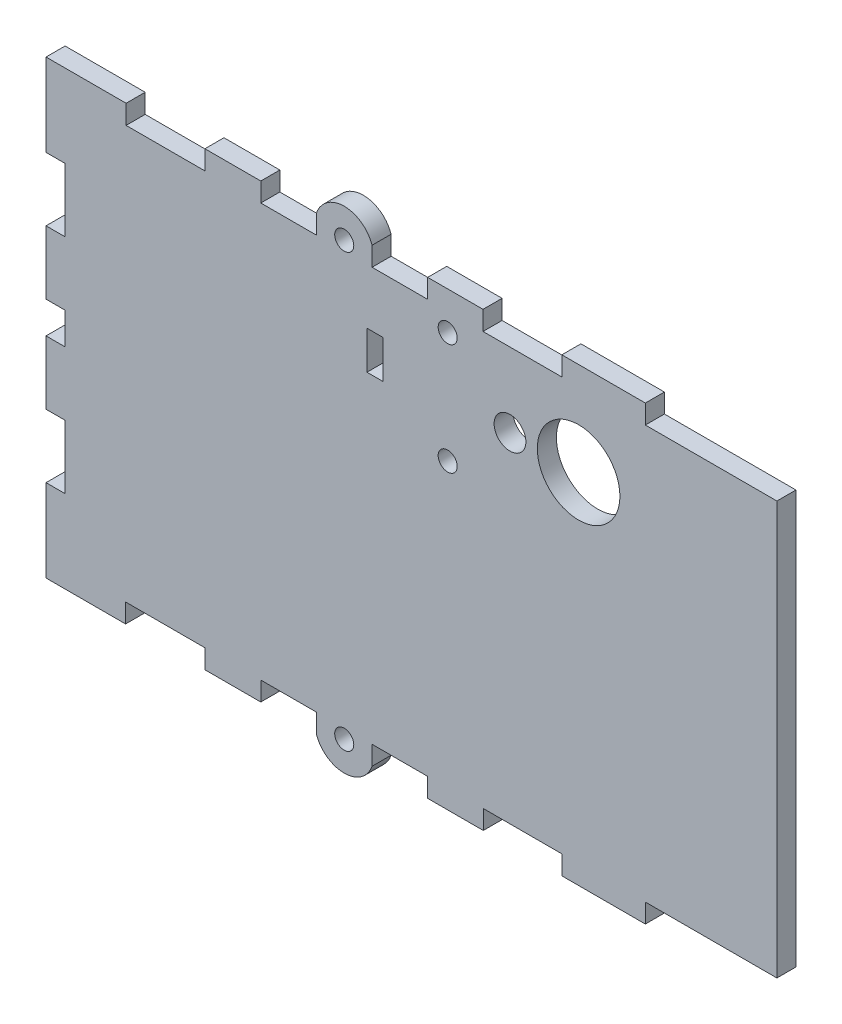
from build123d import *

# Parameters (mm, degrees)
CROQUIS1_R              = 1.500000001
SALIENTE_EXTRUIR1_DEPTH = 3
CROQUIS4_W              = 3
CROQUIS4_H              = 71.0001277
SALIENTE_EXTRUIR2_DEPTH = 15
CROQUIS5_R              = 6.5
CROQUIS5_R_2            = 1.5
CROQUIS5_R_3            = 2.5
CROQUIS5_W              = 2.499996062
CROQUIS5_H              = 6.000001641
CORTAR_EXTRUIR1_DEPTH   = 10
CORTAR_EXTRUIR3_START   = -3
CORTAR_EXTRUIR3_DEPTH   = 3


# Read off the part's stored shape, not the designer's step: Cortar-Extruir3
with BuildPart() as part:
    # Croquis1 → Saliente-Extruir1 (new body)
    with BuildSketch(Plane.XY):
        with BuildLine():
            Line((314.494178041, 188.579504075), (317.494178043, 188.579506619))
            Line((317.494178043, 188.579506619), (317.494186524, 178.579506615))
            Line((317.494186524, 178.579506615), (314.494177731, 178.579504071))
            Line((314.494177731, 178.579504071), (314.494186212, 168.579504067))
            Line((314.494186212, 168.579504067), (317.494186214, 168.579506611))
            Line((317.494186214, 168.579506611), (317.494190454, 163.579648323))
            Line((317.494190454, 163.579648323), (314.494168474, 163.579645778))
            Line((314.494168474, 163.579645778), (314.494176956, 153.579645774))
            Line((314.494176956, 153.579645774), (317.494159374, 153.579648318))
            Line((317.494159374, 153.579648318), (317.494167855, 143.579648314))
            Line((317.494167855, 143.579648314), (314.494167854, 143.57964577))
            Line((314.494167854, 143.57964577), (314.494173605, 130.579645765))
            Line((314.494173605, 130.579645765), (327.013519861, 130.579618443))
            Line((327.013519861, 130.579618443), (327.013522591, 133.579618444))
            Line((327.013522591, 133.579618444), (339.532765197, 133.579591123))
            Line((339.532765197, 133.579591123), (339.532765197, 130.57943755))
            Line((339.532765197, 130.57943755), (348.284914925, 130.579428178))
            Line((348.284914925, 130.579428178), (348.284918137, 133.579395242))
            Line((348.284918137, 133.579395242), (357.034918141, 133.579385871))
            Line((357.034918141, 133.579385871), (357.034914928, 130.57938587))
            ThreePointArc((357.034914928, 130.57938587), (361.414562849, 127.449962294), (365.794217472, 130.57937649))
            Line((365.794217472, 130.57937649), (365.794220685, 133.579299126))
            Line((365.794220685, 133.579299126), (374.544220688, 133.579289756))
            Line((374.544220688, 133.579289756), (374.544217476, 130.579290106))
            Line((374.544217476, 130.579290106), (383.294100119, 130.579288157))
            Line((383.294100119, 130.579288157), (383.294100787, 133.579288158))
            Line((383.294100787, 133.579288158), (395.694123645, 133.579285396))
            Line((395.694123645, 133.579285396), (395.694122977, 130.579285394))
            Line((395.694122977, 130.579285394), (414.49422245, 130.579281206))
            Line((414.49422245, 130.579281206), (414.494175849, 201.579408906))
            Line((414.494175849, 201.579408906), (395.654796079, 201.579436111))
            Line((395.654796079, 201.579436111), (395.654796079, 198.559911251))
            Line((395.654796079, 198.559911251), (383.254781657, 198.559889448))
            Line((383.254781657, 198.559889448), (383.254781657, 201.579454018))
            Line((383.254781657, 201.579454018), (374.544176149, 201.579466597))
            Line((374.544176149, 201.579466597), (374.544170874, 198.579568646))
            Line((374.544170874, 198.579568646), (365.794170871, 198.579584031))
            Line((365.794170871, 198.579584031), (365.794176145, 201.579506668))
            ThreePointArc((365.794176145, 201.579506668), (361.414530376, 204.708933254), (357.034873601, 201.579522069))
            Line((357.034873601, 201.579522069), (357.034868326, 198.579522068))
            Line((357.034868326, 198.579522068), (348.284868323, 198.579537453))
            Line((348.284868323, 198.579537453), (348.284873598, 201.579504517))
            Line((348.284873598, 201.579504517), (339.493492813, 201.579517212))
            Line((339.493492813, 201.579517212), (339.493492813, 198.559812504))
            Line((339.493492813, 198.559812504), (327.093469951, 198.559790701))
            Line((327.093469951, 198.559790701), (327.093469951, 201.579535118))
            Line((327.093469951, 201.579535118), (314.494181082, 201.579553313))
            Line((314.494181082, 201.579553313), (314.494178041, 188.579504075))
        make_face()
        with Locations((361.414522236, 200.079542161)):
            Circle(CROQUIS1_R, mode=Mode.SUBTRACT)
        with Locations((361.414567806, 132.079353387)):
            Circle(CROQUIS1_R, mode=Mode.SUBTRACT)
    extrude(amount=SALIENTE_EXTRUIR1_DEPTH)

    # Croquis4 → Saliente-Extruir2 (add)
    with BuildSketch(Plane(origin=(414.494308155, 0.000272052, 0), x_dir=(0, 0, -1), z_dir=(0.9999999999997846, 6.563478556519826e-07, 0))):
        with Locations((-1.5, 166.079073004)):
            Rectangle(CROQUIS4_W, CROQUIS4_H)
    extrude(amount=SALIENTE_EXTRUIR2_DEPTH)

    # Croquis5 → Cortar-Extruir1 (cut)
    with BuildSketch(Plane.XY.offset(3)):
        with Locations((398.2941855, 186.875664671)):
            Circle(CROQUIS5_R)
        with Locations((377.694191243, 178.12565115)):
            Circle(CROQUIS5_R_2)
        with Locations((377.694179757, 195.62565115)):
            Circle(CROQUIS5_R_2)
        with Locations((387.4941855, 186.875657583)):
            Circle(CROQUIS5_R_3)
        with Locations((366.2441855, 186.875643636)):
            Rectangle(CROQUIS5_W, CROQUIS5_H)
    extrude(amount=-CORTAR_EXTRUIR1_DEPTH, mode=Mode.SUBTRACT)

    # Cortar-Extruir3 outline → Cortar-Extruir3 (cut)
    with BuildSketch(Plane(origin=(0, 0, 0), x_dir=(-1, 0, 0), z_dir=(0, 0, -1)).offset(CORTAR_EXTRUIR3_START)):
        Polygon((-429.494177993, 198.579387245), (-408.794180476, 198.579417137), (-408.794180476, 201.579419823), (-414.494175849, 201.579408906), (-429.494175849, 201.579418751), align=None)
        Polygon((-408.794229793, 133.579285396), (-429.49422245, 133.579285396), (-429.49422245, 130.579291051), (-414.49422245, 130.579281206), (-408.794229793, 130.579282476), align=None)
    extrude(amount=CORTAR_EXTRUIR3_DEPTH, mode=Mode.SUBTRACT)


solid = part.part
